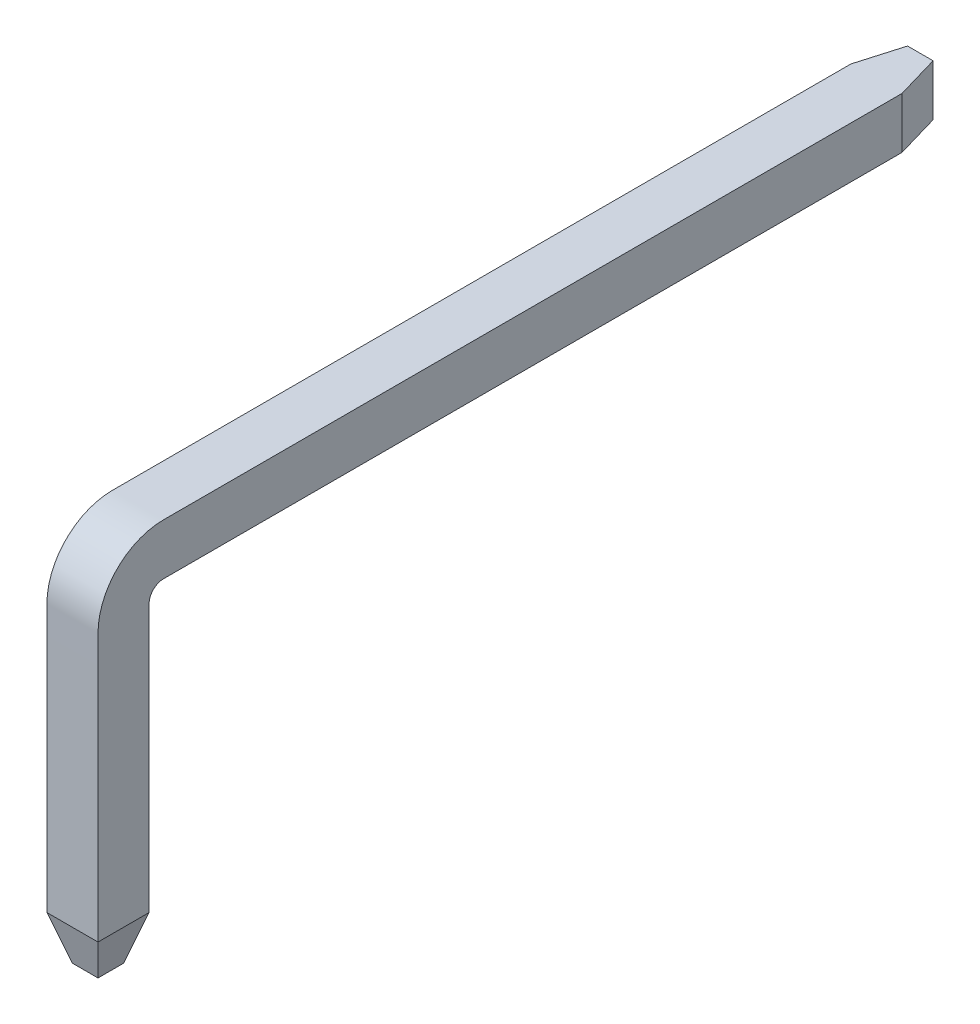
from build123d import *
from OCP.BRepFilletAPI import BRepFilletAPI_MakeChamfer

# Parameters (mm, degrees)
CHAMFER_1_SIZE   = 0.16
CHAMFER_1_SIZE_2 = 0.55
CHAMFER_2_SIZE   = 0.55
CHAMFER_2_SIZE2  = 0.16


with BuildPart() as part:
    # По траектории1: read off the stored shape, not the designer's step
    # По траектории1: loft between two sections, ruled curve by curve
    sweep_1_from = [
        Edge.make_bspline([(-0.32, -4.4, 9.98), (-0.32, -3.75, 9.98), (-0.32, -3.1, 9.98), (-0.32, -2.125, 9.98), (-0.32, -1.8, 9.98), (-0.32, -1.3125, 9.98), (-0.32, -1.15, 9.98), (-0.32, -0.90625, 9.98), (-0.32, -0.825, 9.98), (-0.32, -0.703125, 9.98), (-0.32, -0.6625, 9.98), (-0.32, -0.58125, 9.98), (-0.32, -0.52762416, 9.980007311), (-0.32, -0.455495458, 9.979988222), (-0.32, -0.453294441, 9.975416347), (-0.32, -0.409822444, 9.957544631), (-0.32, -0.389586863, 9.944145305), (-0.32, -0.355854695, 9.910413137), (-0.32, -0.342455369, 9.890177556), (-0.32, -0.324583653, 9.846705559), (-0.32, -0.320011778, 9.844504542), (-0.32, -0.319990815, 9.765292722), (-0.32, -0.32, 9.697916667), (-0.32, -0.32, 9.595833333), (-0.32, -0.32, 9.544791667), (-0.32, -0.32, 9.391666667), (-0.32, -0.32, 9.289583333), (-0.32, -0.32, 8.983333333), (-0.32, -0.32, 8.779166667), (-0.32, -0.32, 8.166666667), (-0.32, -0.32, 7.758333333), (-0.32, -0.32, 6.533333333), (-0.32, -0.32, 5.716666667), (-0.32, -0.32, 3.266666667), (-0.32, -0.32, 1.633333333), (-0.32, -0.32, 0)], [0, 0, 0, 0, 0.134618322, 0.134618322, 0.201927484, 0.201927484, 0.235582064, 0.235582064, 0.252409354, 0.252409354, 0.260823, 0.260823, 0.269236645, 0.269236645, 0.282791643, 0.282791643, 0.29634664, 0.29634664, 0.309901638, 0.309901638, 0.323456636, 0.323456636, 0.334027626, 0.334027626, 0.344598616, 0.344598616, 0.365740596, 0.365740596, 0.408024557, 0.408024557, 0.492592477, 0.492592477, 0.661728318, 0.661728318, 1, 1, 1, 1], 3),
        Edge.make_bspline([(-0.32, -4.4, 10.62), (-0.32, -3.75, 10.62), (-0.32, -3.1, 10.62), (-0.32, -2.125, 10.62), (-0.32, -1.8, 10.62), (-0.32, -1.3125, 10.62), (-0.32, -1.15, 10.62), (-0.32, -0.90625, 10.62), (-0.32, -0.825, 10.62), (-0.32, -0.703125, 10.62), (-0.32, -0.6625, 10.62), (-0.32, -0.58125, 10.62), (-0.32, -0.553621172, 10.620033305), (-0.32, -0.413612368, 10.619946343), (-0.32, -0.287230231, 10.599118915), (-0.32, -0.089191132, 10.517703317), (-0.32, 0.002993178, 10.456661943), (-0.32, 0.156661943, 10.302993178), (-0.32, 0.217703317, 10.210808868), (-0.32, 0.299118915, 10.012769769), (-0.32, 0.319946343, 9.886387632), (-0.32, 0.320041845, 9.732629809), (-0.32, 0.32, 9.697916667), (-0.32, 0.32, 9.595833333), (-0.32, 0.32, 9.544791667), (-0.32, 0.32, 9.391666667), (-0.32, 0.32, 9.289583333), (-0.32, 0.32, 8.983333333), (-0.32, 0.32, 8.779166667), (-0.32, 0.32, 8.166666667), (-0.32, 0.32, 7.758333333), (-0.32, 0.32, 6.533333333), (-0.32, 0.32, 5.716666667), (-0.32, 0.32, 3.266666667), (-0.32, 0.32, 1.633333333), (-0.32, 0.32, 0)], [0, 0, 0, 0, 0.134618322, 0.134618322, 0.201927484, 0.201927484, 0.235582064, 0.235582064, 0.252409354, 0.252409354, 0.260823, 0.260823, 0.269236645, 0.269236645, 0.282791643, 0.282791643, 0.29634664, 0.29634664, 0.309901638, 0.309901638, 0.323456636, 0.323456636, 0.334027626, 0.334027626, 0.344598616, 0.344598616, 0.365740596, 0.365740596, 0.408024557, 0.408024557, 0.492592477, 0.492592477, 0.661728318, 0.661728318, 1, 1, 1, 1], 3),
        Edge.make_line((-0.32, -4.4, 10.62), (-0.32, -4.4, 9.98)),
        Edge.make_line((-0.32, 0.32, 0), (-0.32, -0.32, 0)),
    ]
    sweep_1_to = [
        Edge.make_bspline([(0.32, -4.4, 9.98), (0.32, -3.75, 9.98), (0.32, -3.1, 9.98), (0.32, -2.125, 9.98), (0.32, -1.8, 9.98), (0.32, -1.3125, 9.98), (0.32, -1.15, 9.98), (0.32, -0.90625, 9.98), (0.32, -0.825, 9.98), (0.32, -0.703125, 9.98), (0.32, -0.6625, 9.98), (0.32, -0.58125, 9.98), (0.32, -0.52762416, 9.980007311), (0.32, -0.455495458, 9.979988222), (0.32, -0.453294441, 9.975416347), (0.32, -0.409822444, 9.957544631), (0.32, -0.389586863, 9.944145305), (0.32, -0.355854695, 9.910413137), (0.32, -0.342455369, 9.890177556), (0.32, -0.324583653, 9.846705559), (0.32, -0.320011778, 9.844504542), (0.32, -0.319990815, 9.765292722), (0.32, -0.32, 9.697916667), (0.32, -0.32, 9.595833333), (0.32, -0.32, 9.544791667), (0.32, -0.32, 9.391666667), (0.32, -0.32, 9.289583333), (0.32, -0.32, 8.983333333), (0.32, -0.32, 8.779166667), (0.32, -0.32, 8.166666667), (0.32, -0.32, 7.758333333), (0.32, -0.32, 6.533333333), (0.32, -0.32, 5.716666667), (0.32, -0.32, 3.266666667), (0.32, -0.32, 1.633333333), (0.32, -0.32, 0)], [0, 0, 0, 0, 0.134618322, 0.134618322, 0.201927484, 0.201927484, 0.235582064, 0.235582064, 0.252409354, 0.252409354, 0.260823, 0.260823, 0.269236645, 0.269236645, 0.282791643, 0.282791643, 0.29634664, 0.29634664, 0.309901638, 0.309901638, 0.323456636, 0.323456636, 0.334027626, 0.334027626, 0.344598616, 0.344598616, 0.365740596, 0.365740596, 0.408024557, 0.408024557, 0.492592477, 0.492592477, 0.661728318, 0.661728318, 1, 1, 1, 1], 3),
        Edge.make_bspline([(0.32, -4.4, 10.62), (0.32, -3.75, 10.62), (0.32, -3.1, 10.62), (0.32, -2.125, 10.62), (0.32, -1.8, 10.62), (0.32, -1.3125, 10.62), (0.32, -1.15, 10.62), (0.32, -0.90625, 10.62), (0.32, -0.825, 10.62), (0.32, -0.703125, 10.62), (0.32, -0.6625, 10.62), (0.32, -0.58125, 10.62), (0.32, -0.553621172, 10.620033305), (0.32, -0.413612368, 10.619946343), (0.32, -0.287230231, 10.599118915), (0.32, -0.089191132, 10.517703317), (0.32, 0.002993178, 10.456661943), (0.32, 0.156661943, 10.302993178), (0.32, 0.217703317, 10.210808868), (0.32, 0.299118915, 10.012769769), (0.32, 0.319946343, 9.886387632), (0.32, 0.320041845, 9.732629809), (0.32, 0.32, 9.697916667), (0.32, 0.32, 9.595833333), (0.32, 0.32, 9.544791667), (0.32, 0.32, 9.391666667), (0.32, 0.32, 9.289583333), (0.32, 0.32, 8.983333333), (0.32, 0.32, 8.779166667), (0.32, 0.32, 8.166666667), (0.32, 0.32, 7.758333333), (0.32, 0.32, 6.533333333), (0.32, 0.32, 5.716666667), (0.32, 0.32, 3.266666667), (0.32, 0.32, 1.633333333), (0.32, 0.32, 0)], [0, 0, 0, 0, 0.134618322, 0.134618322, 0.201927484, 0.201927484, 0.235582064, 0.235582064, 0.252409354, 0.252409354, 0.260823, 0.260823, 0.269236645, 0.269236645, 0.282791643, 0.282791643, 0.29634664, 0.29634664, 0.309901638, 0.309901638, 0.323456636, 0.323456636, 0.334027626, 0.334027626, 0.344598616, 0.344598616, 0.365740596, 0.365740596, 0.408024557, 0.408024557, 0.492592477, 0.492592477, 0.661728318, 0.661728318, 1, 1, 1, 1], 3),
        Edge.make_line((0.32, -4.4, 10.62), (0.32, -4.4, 9.98)),
        Edge.make_line((0.32, 0.32, 0), (0.32, -0.32, 0)),
    ]
    sweep_1 = Solid(Shell([*[Face.make_surface_from_curves(sweep_1_from[k], sweep_1_to[k]) for k in range(4)], Face(Wire(sweep_1_from)), Face(Wire(sweep_1_to))]))
    add(sweep_1)

    # Фаска1
    # the kernel refuses this chamfer: 0.55, 0.16 mm, written as the material it takes off along each edge
    with BuildSketch(Plane(origin=(-0.32, 1.747893392, 0), x_dir=(1, 0, 0), z_dir=(0, -1, 0))) as chamfer_1_piece_1:
        Polygon((CHAMFER_1_SIZE, 0), (0, CHAMFER_1_SIZE_2), (0, 0), align=None)
    extrude(amount=3.495786784, mode=Mode.SUBTRACT)
    with BuildSketch(Plane(origin=(0.32, 1.747893392, 0), x_dir=(-1, 0, 0), z_dir=(0, -1, 0))) as chamfer_1_piece_2:
        Polygon((CHAMFER_1_SIZE, 0), (0, -CHAMFER_1_SIZE_2), (0, 0), align=None)
    extrude(amount=3.495786784, mode=Mode.SUBTRACT)

    # Фаска2: one chamfer whose edges measure the first distance from different faces: ONE call of the kernel's chamfer builder (chamfer() names one face for all edges)
    chamfer_2_edges_1 = [part.edges().sort_by_distance(p)[0] for p in [
        (-0.32, -4.4, 10.3),
    ]]
    chamfer_2_side_1 = [part.faces().sort_by_distance(p)[0] for p in [
        (-0.32, -4.288786791, 10.3),
    ]]
    chamfer_2_edges_2 = [part.edges().sort_by_distance(p)[0] for p in [
        (0, -4.4, 10.62),
    ]]
    chamfer_2_side_2 = [part.faces().sort_by_distance(p)[0] for p in [
        (0, 0.32, 7.242699081),
    ]]
    chamfer_2_edges_3 = [part.edges().sort_by_distance(p)[0] for p in [
        (0.32, -4.4, 10.3),
    ]]
    chamfer_2_side_3 = [part.faces().sort_by_distance(p)[0] for p in [
        (0.32, -4.288786791, 10.3),
    ]]
    chamfer_2_edges_4 = [part.edges().sort_by_distance(p)[0] for p in [
        (0, -4.4, 9.98),
    ]]
    chamfer_2_side_4 = [part.faces().sort_by_distance(p)[0] for p in [
        (0, -0.32, 7.242699081),
    ]]
    chamfer_2 = BRepFilletAPI_MakeChamfer(part.part.solid().wrapped)
    for e in chamfer_2_edges_1:
        chamfer_2.Add(CHAMFER_2_SIZE, CHAMFER_2_SIZE2, e.wrapped, chamfer_2_side_1[0].wrapped)  # the first distance lies on this face
    for e in chamfer_2_edges_2:
        chamfer_2.Add(CHAMFER_2_SIZE, CHAMFER_2_SIZE2, e.wrapped, chamfer_2_side_2[0].wrapped)  # the first distance lies on this face
    for e in chamfer_2_edges_3:
        chamfer_2.Add(CHAMFER_2_SIZE, CHAMFER_2_SIZE2, e.wrapped, chamfer_2_side_3[0].wrapped)  # the first distance lies on this face
    for e in chamfer_2_edges_4:
        chamfer_2.Add(CHAMFER_2_SIZE, CHAMFER_2_SIZE2, e.wrapped, chamfer_2_side_4[0].wrapped)  # the first distance lies on this face
    add(Compound.cast(chamfer_2.Shape()), mode=Mode.REPLACE)


solid = part.part
